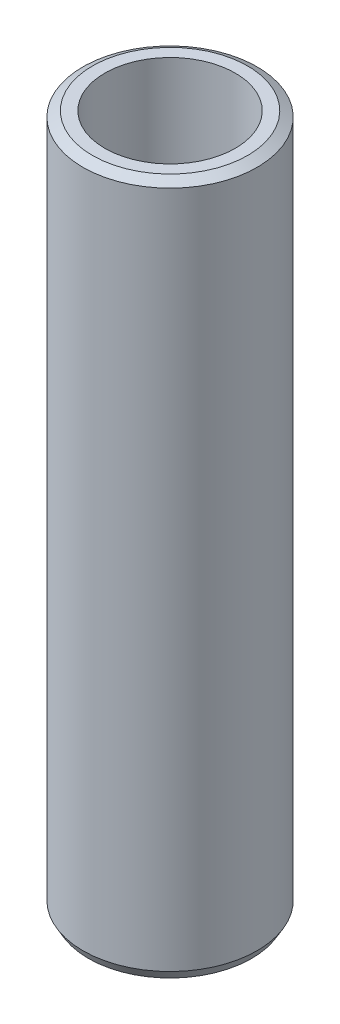
from build123d import *
from OCP.BRepFilletAPI import BRepFilletAPI_MakeChamfer

# Parameters (mm, degrees)
SKETCH1_R           = 35
BOSS_EXTRUDE1_DEPTH = 278.606741562
SKETCH2_R           = 26.20253666
CUT_EXTRUDE1_DEPTH  = 283.969462034
CHAMFER1_SIZE       = 2.207726463
CHAMFER1_SIZE2      = 3.823894403


with BuildPart() as part:
    # Sketch1 → Boss-Extrude1 (new body)
    with BuildSketch(Plane(origin=(0, 0, 0), x_dir=(1, 0, 0), z_dir=(0, 1, 0))):
        Circle(SKETCH1_R)
    extrude(amount=BOSS_EXTRUDE1_DEPTH)

    # Sketch2 → Cut-Extrude1 (cut, through all)
    with BuildSketch(Plane(origin=(0, 0, 0), x_dir=(1, 0, 0), z_dir=(0, 1, 0))):
        Circle(SKETCH2_R)
    extrude(amount=CUT_EXTRUDE1_DEPTH, mode=Mode.SUBTRACT)

    # Chamfer1: one chamfer whose edges measure the first distance from different faces: ONE call of the kernel's chamfer builder (chamfer() names one face for all edges)
    chamfer1_edges_1 = [part.edges().sort_by_distance(p)[0] for p in [
        (-35, 278.606741562, 0),
    ]]
    chamfer1_side_1 = [part.faces().sort_by_distance(p)[0] for p in [
        (-35, 139.303370781, 0),
    ]]
    chamfer1_edges_2 = [part.edges().sort_by_distance(p)[0] for p in [
        (-35, 0, 0),
    ]]
    chamfer1_side_2 = [part.faces().sort_by_distance(p)[0] for p in [
        (-34.010050506, 0, 0),
    ]]
    chamfer1 = BRepFilletAPI_MakeChamfer(part.part.solid().wrapped)
    for e in chamfer1_edges_1:
        chamfer1.Add(CHAMFER1_SIZE, CHAMFER1_SIZE2, e.wrapped, chamfer1_side_1[0].wrapped)  # the first distance lies on this face
    for e in chamfer1_edges_2:
        chamfer1.Add(CHAMFER1_SIZE, CHAMFER1_SIZE2, e.wrapped, chamfer1_side_2[0].wrapped)  # the first distance lies on this face
    add(Compound.cast(chamfer1.Shape()), mode=Mode.REPLACE)


solid = part.part
